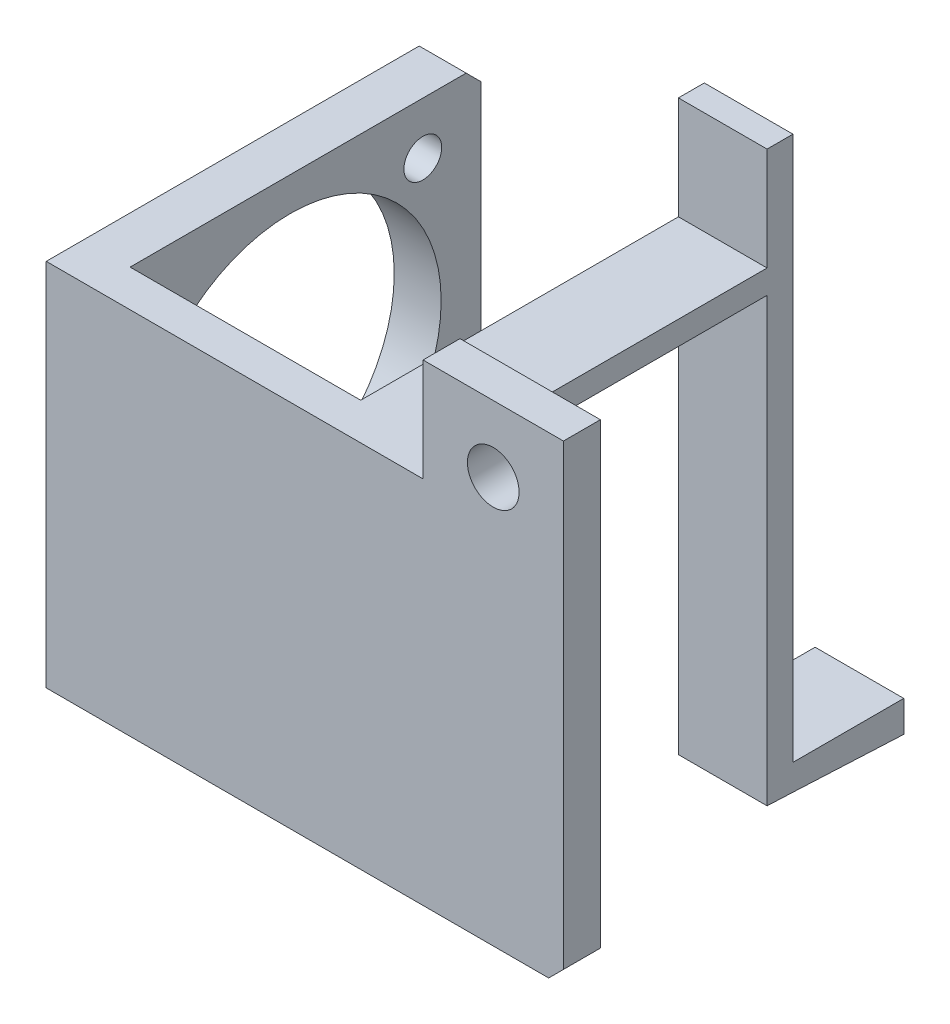
from build123d import *

# Parameters (mm, degrees)
BOSS_EXTRUDE1_DEPTH   = 5
SKETCH2_W             = 6.35
SKETCH2_H             = 50
BOSS_EXTRUDE2_DEPTH   = 52.48
CUT_EXTRUDE1_REACH    = 106.448
SKETCH3_R             = 20.44
SKETCH3_R_2           = 2.555
SKETCH3_W             = 5
SKETCH3_H             = 50
CUT_EXTRUDE2_REACH    = 108.104
SKETCH4_R             = 3.5
CUT_EXTRUDE6_REACH    = 108.104
SKETCH14_W            = 23.196263878
SKETCH14_H            = 15.316152196
SKETCH15_W            = 12
SKETCH15_H            = 3.2
BOSS_EXTRUDE7_DEPTH   = 46.5
BOSS_EXTRUDE8_REACH   = 98.667
SKETCH16_W            = 12
SKETCH16_H            = 3.5
SKETCH17_W            = 12
SKETCH17_H            = 3.5
BOSS_EXTRUDE9_DEPTH   = 15
CHAMFER2_SIZE         = 2
SKETCH22_W            = 12
SKETCH22_H            = 15
BOSS_EXTRUDE10_DEPTH  = 0.72
CUT_EXTRUDE8_REACH    = 103.606
CUT_EXTRUDE7_REACH    = 120.762
SKETCH18_R            = 3.25
MIRROR2_OUTLINE_W     = 50
MIRROR2_OUTLINE_H     = 5
MIRROR2_DEPTH         = 68
MIRROR2_2_OUTLINE_R   = 2.555
MIRROR2_2_OUTLINE_R_2 = 20.44
MIRROR2_2_DEPTH       = 6.35
MIRROR2_START         = 37.56
MIRROR2_3_DEPTH       = 12
MIRROR2_START_2       = 51
MIRROR2_4_OUTLINE_W   = 13.938985111
MIRROR2_4_OUTLINE_H   = 5
MIRROR2_4_DEPTH       = 5.9999999
MIRROR2_START_3       = 64.0000001
MIRROR2_5_OUTLINE_W   = 13.938985111
MIRROR2_5_OUTLINE_H   = 5
MIRROR2_5_DEPTH       = 5.9999999
MIRROR2_6_DEPTH       = 5
BOSS_EXTRUDE11_DEPTH  = 12
CUT_EXTRUDE9_REACH    = 132.799
SKETCH26_W            = 121.241742099
SKETCH26_H            = 103.992632166


with BuildPart() as part:
    # Sketch1 → Boss-Extrude1 (new body)
    with BuildSketch(Plane.XY):
        Polygon((0, 0), (0, 50), (51, 50), (51, 64.061014889), (70, 64.061014889), (70, -13.938985111), (51, -13.938985111), (51, 0), align=None)
    extrude(amount=BOSS_EXTRUDE1_DEPTH)

    # Sketch2 → Boss-Extrude2 (add)
    with BuildSketch(Plane(origin=(0, 0, 0), x_dir=(-1, 0, 0), z_dir=(0, 0, -1))):
        with Locations((-3.175, 25)):
            Rectangle(SKETCH2_W, SKETCH2_H)
    extrude(amount=BOSS_EXTRUDE2_DEPTH)

    # Sketch3 → Cut-Extrude1 (cut, up to next)
    with BuildSketch(Plane(origin=(6.35, 0, 0), x_dir=(0, 0, -1), z_dir=(1, 0, 0)), mode=Mode.PRIVATE) as cut_extrude1_sk1:
        with Locations((21.66, 25)):
            Circle(SKETCH3_R)
    cut_extrude1_tool1 = extrude(cut_extrude1_sk1.sketch, amount=-CUT_EXTRUDE1_REACH, mode=Mode.PRIVATE) & part.part
    # Sketch3 → Cut-Extrude1 (cut, up to next)
    with BuildSketch(Plane(origin=(6.35, 0, 0), x_dir=(0, 0, -1), z_dir=(1, 0, 0)), mode=Mode.PRIVATE) as cut_extrude1_sk2:
        with Locations((3.695, 42.955)):
            Circle(SKETCH3_R_2)
    cut_extrude1_tool2 = extrude(cut_extrude1_sk2.sketch, amount=-CUT_EXTRUDE1_REACH, mode=Mode.PRIVATE) & part.part
    # Sketch3 → Cut-Extrude1 (cut, up to next)
    with BuildSketch(Plane(origin=(6.35, 0, 0), x_dir=(0, 0, -1), z_dir=(1, 0, 0)), mode=Mode.PRIVATE) as cut_extrude1_sk3:
        with Locations((39.615, 7.045)):
            Circle(SKETCH3_R_2)
    cut_extrude1_tool3 = extrude(cut_extrude1_sk3.sketch, amount=-CUT_EXTRUDE1_REACH, mode=Mode.PRIVATE) & part.part
    # Sketch3 → Cut-Extrude1 (cut, up to next)
    with BuildSketch(Plane(origin=(6.35, 0, 0), x_dir=(0, 0, -1), z_dir=(1, 0, 0)), mode=Mode.PRIVATE) as cut_extrude1_sk4:
        with Locations((49.98, 25)):
            Rectangle(SKETCH3_W, SKETCH3_H)
    cut_extrude1_tool4 = extrude(cut_extrude1_sk4.sketch, amount=-CUT_EXTRUDE1_REACH, mode=Mode.PRIVATE) & part.part
    add(cut_extrude1_tool1.solids().sort_by_distance((6.35, 25, -21.66))[0], mode=Mode.SUBTRACT)
    add(cut_extrude1_tool2.solids().sort_by_distance((6.35, 42.955, -3.695))[0], mode=Mode.SUBTRACT)
    add(cut_extrude1_tool3.solids().sort_by_distance((6.35, 7.045, -39.615))[0], mode=Mode.SUBTRACT)
    add(cut_extrude1_tool4.solids().sort_by_distance((6.35, 25, -49.98))[0], mode=Mode.SUBTRACT)

    # Sketch4 → Cut-Extrude2 (cut, up to next)
    with BuildSketch(Plane(origin=(0, 0, 0), x_dir=(-1, 0, 0), z_dir=(0, 0, -1)), mode=Mode.PRIVATE) as cut_extrude2_sk1:
        with Locations((-60.5, 55.061014889)):
            Circle(SKETCH4_R)
    cut_extrude2_tool1 = extrude(cut_extrude2_sk1.sketch, amount=-CUT_EXTRUDE2_REACH, mode=Mode.PRIVATE) & part.part
    # Sketch4 → Cut-Extrude2 (cut, up to next)
    with BuildSketch(Plane(origin=(0, 0, 0), x_dir=(-1, 0, 0), z_dir=(0, 0, -1)), mode=Mode.PRIVATE) as cut_extrude2_sk2:
        with Locations((-60.5, -4.938985111)):
            Circle(SKETCH4_R)
    cut_extrude2_tool2 = extrude(cut_extrude2_sk2.sketch, amount=-CUT_EXTRUDE2_REACH, mode=Mode.PRIVATE) & part.part
    add(cut_extrude2_tool1.solids().sort_by_distance((60.5, 55.061015, 0))[0], mode=Mode.SUBTRACT)
    add(cut_extrude2_tool2.solids().sort_by_distance((60.5, -4.938985, 0))[0], mode=Mode.SUBTRACT)

    # Sketch14 → Cut-Extrude6 (cut, up to next)
    with BuildSketch(Plane(origin=(0, 0, 0), x_dir=(-1, 0, 0), z_dir=(0, 0, -1)), mode=Mode.PRIVATE) as cut_extrude6_sk1:
        with Locations((-62.598131939, 57.658076098)):
            Rectangle(SKETCH14_W, SKETCH14_H)
    cut_extrude6_tool1 = extrude(cut_extrude6_sk1.sketch, amount=-CUT_EXTRUDE6_REACH, mode=Mode.PRIVATE) & part.part
    add(cut_extrude6_tool1.solids().sort_by_distance((62.598132, 57.658076, 0))[0], mode=Mode.SUBTRACT)

    # Sketch15 → Boss-Extrude7 (add)
    with BuildSketch(Plane(origin=(0, 0, 0), x_dir=(-1, 0, 0), z_dir=(0, 0, -1))):
        with Locations((-43.56, 1.6)):
            Rectangle(SKETCH15_W, SKETCH15_H)
    extrude(amount=BOSS_EXTRUDE7_DEPTH)

    # Boss-Extrude8: up to this plane
    boss_extrude8_end = Plane(origin=(166.832994776, 64.085435133, -66.619565524), z_dir=(-1.1416993347548052e-15, 0.9990256874715413, 0.04413247978546202))
    # Sketch16 → Boss-Extrude8 (add, up to the surface)
    with BuildSketch(Plane(origin=(0, 3.2, 0), x_dir=(1, 0, 0), z_dir=(0, 1, 0)), mode=Mode.PRIVATE) as boss_extrude8_sk1:
        with Locations((43.56, 44.75)):
            Rectangle(SKETCH16_W, SKETCH16_H)
    boss_extrude8_tool1 = split(extrude(boss_extrude8_sk1.sketch, amount=BOSS_EXTRUDE8_REACH, mode=Mode.PRIVATE), bisect_by=boss_extrude8_end, keep=Keep.BOTH, mode=Mode.PRIVATE)
    add(boss_extrude8_tool1.solids().sort_by_distance((43.56, 3.2, -44.75))[0])

    # Sketch17 → Boss-Extrude9 (add)
    with BuildSketch(Plane(origin=(0, 0, -46.5), x_dir=(-1, 0, 0), z_dir=(0, 0, -1))):
        with Locations((-43.56, 61.446642853)):
            Rectangle(SKETCH17_W, SKETCH17_H)
    extrude(amount=BOSS_EXTRUDE9_DEPTH)

    # Chamfer2
    chamfer2_edges = [part.edges().sort_by_distance(p)[0] for p in [
        (3.175, 0, -47.48),
        (3.175, 50, -47.48),
        (70, 50, 2.5),
    ]]
    chamfer(chamfer2_edges, length=CHAMFER2_SIZE)

    # Sketch22 → Boss-Extrude10 (add)
    with BuildSketch(Plane(origin=(0, 63.196642853, 0), x_dir=(1, 0, 0), z_dir=(0, 1, 0))):
        with Locations((43.56, 54)):
            Rectangle(SKETCH22_W, SKETCH22_H)
    extrude(amount=BOSS_EXTRUDE10_DEPTH)

    # Sketch23 → Cut-Extrude8 (cut, up to next)
    with BuildSketch(Plane(origin=(49.56, 0, 0), x_dir=(0, 0, -1), z_dir=(1, 0, 0)), mode=Mode.PRIVATE) as cut_extrude8_sk1:
        Polygon((46.5, 63.916642853), (46.5, 63.196642853), (61.5, 63.916642853), align=None)
    cut_extrude8_tool1 = extrude(cut_extrude8_sk1.sketch, amount=-CUT_EXTRUDE8_REACH, mode=Mode.PRIVATE) & part.part
    add(cut_extrude8_tool1.solids().sort_by_distance((49.56, 63.676643, -51.5))[0], mode=Mode.SUBTRACT)

    # Cut-Extrude7: up to this plane
    cut_extrude7_end = Plane(origin=(-0.001, 63.196642853, -46.5), z_dir=(-2.1659106514416256e-15, -0.9988499868416298, -0.04794479936839813))
    # Sketch18 → Cut-Extrude7 (cut, up to the surface)
    with BuildSketch(Plane.XZ.offset(-59.696642853), mode=Mode.PRIVATE) as cut_extrude7_sk1:
        with Locations(Location((43.56, -52.57, 0), (0, 0, 270))):
            Circle(SKETCH18_R)
    cut_extrude7_tool1 = split(extrude(cut_extrude7_sk1.sketch, amount=-CUT_EXTRUDE7_REACH, mode=Mode.PRIVATE), bisect_by=cut_extrude7_end, keep=Keep.BOTH, mode=Mode.PRIVATE)
    add(cut_extrude7_tool1.solids().sort_by_distance((43.56, 59.696643, -52.57))[0], mode=Mode.SUBTRACT)



with BuildPart() as body_2:
    # Mirror2: read off the stored shape, not the designer's step
    # Mirror2 outline → Mirror2 (new body)
    with BuildSketch(Plane.YZ):
        with Locations((-52.877970222, 2.5)):
            Rectangle(MIRROR2_OUTLINE_W, MIRROR2_OUTLINE_H)
    extrude(amount=MIRROR2_DEPTH)

    # Mirror2 2 outline → Mirror2 2 (add)
    with BuildSketch(Plane.YZ):
        Polygon((-27.877970222, -45.48), (-27.877970222, 0), (-77.877970222, 0), (-77.877970222, -45.48), (-75.877970222, -47.48), (-29.877970222, -47.48), align=None)
        with Locations((-34.922970222, -39.615)):
            Circle(MIRROR2_2_OUTLINE_R, mode=Mode.SUBTRACT)
        with Locations((-70.832970222, -3.695)):
            Circle(MIRROR2_2_OUTLINE_R, mode=Mode.SUBTRACT)
        with Locations((-52.877970222, -21.66)):
            Circle(MIRROR2_2_OUTLINE_R_2, mode=Mode.SUBTRACT)
    extrude(amount=MIRROR2_2_DEPTH)


with BuildPart() as part_1:
    add(part.part)

    add(body_2.part)  # Mirror2 3 merges body 2
    # Mirror2 3 outline → Mirror2 3 (add)
    with BuildSketch(Plane.YZ.offset(MIRROR2_START)):
        Polygon((-31.077970222, -46.5), (0, -46.5), (0, -43), (-27.877970222, -43), (-27.877970222, 0), (-31.077970222, 0), align=None)
    extrude(amount=MIRROR2_3_DEPTH)

    # Mirror2 4 outline → Mirror2 4 (add)
    with BuildSketch(Plane.YZ.offset(MIRROR2_START_2)):
        with Locations((-20.908477667, 2.5)):
            Rectangle(MIRROR2_4_OUTLINE_W, MIRROR2_4_OUTLINE_H)
    extrude(amount=MIRROR2_4_DEPTH)

    # Mirror2 5 outline → Mirror2 5 (add)
    with BuildSketch(Plane.YZ.offset(MIRROR2_START_3)):
        with Locations((-20.908477667, 2.5)):
            Rectangle(MIRROR2_5_OUTLINE_W, MIRROR2_5_OUTLINE_H)
    extrude(amount=MIRROR2_5_DEPTH)

    # Mirror2 6 outline → Mirror2 6 (add)
    with BuildSketch(Plane.XY):
        Polygon((70, -75.877970222), (70, -27.877970222), (68, -27.877970222), (68, -77.877970222), align=None)
        with BuildLine():
            Line((64.0000001, -27.877970222), (64, -22.938985111))
            ThreePointArc((64, -22.938985111), (60.5, -26.438985111), (57, -22.938985111))
            Line((57, -22.938985111), (56.9999999, -27.877970222))
            Line((56.9999999, -27.877970222), (64.0000001, -27.877970222))
        make_face()
        with BuildLine():
            ThreePointArc((57, -22.938985111), (60.5, -19.438985111), (64, -22.938985111))
            Line((64, -22.938985111), (64.0000001, -13.938985111))
            Line((64.0000001, -13.938985111), (56.9999999, -13.938985111))
            Line((56.9999999, -13.938985111), (57, -22.938985111))
        make_face()
    extrude(amount=MIRROR2_6_DEPTH)

    # Sketch25 → Boss-Extrude11 (add)
    with BuildSketch(Plane(origin=(49.56, 0, 0), x_dir=(0, 0, -1), z_dir=(1, 0, 0))):
        Polygon((43, -13.938985111), (46.5, -13.938985111), (46.5, -87.574613075), (61.5, -87.574613075), (61.5, -91.794613075), (46.5, -91.074613075), (43, -90.919998753), (43, -31.077970222), align=None)
    extrude(amount=-BOSS_EXTRUDE11_DEPTH)

    # Cut-Extrude9: up to this face of the body (flat: up to its plane)
    cut_extrude9_end = Plane(part_1.part.faces().sort_by_distance((0, 0.724855186, -20.24))[0])
    # Sketch26 → Cut-Extrude9 (cut, up to the picked face)
    with BuildSketch(Plane(origin=(70, 0, 0), x_dir=(0, 0, -1), z_dir=(1, 0, 0)), mode=Mode.PRIVATE) as cut_extrude9_sk1:
        with Locations((55.62087105, 38.057330972)):
            Rectangle(SKETCH26_W, SKETCH26_H)
    cut_extrude9_tool1 = split(extrude(cut_extrude9_sk1.sketch, amount=-CUT_EXTRUDE9_REACH, mode=Mode.PRIVATE), bisect_by=cut_extrude9_end, keep=Keep.BOTH, mode=Mode.PRIVATE)
    add(cut_extrude9_tool1.solids().sort_by(Axis((70, 38.057331, -55.620871), (-1, 0, 0)))[0], mode=Mode.SUBTRACT)


solid = part_1.part
